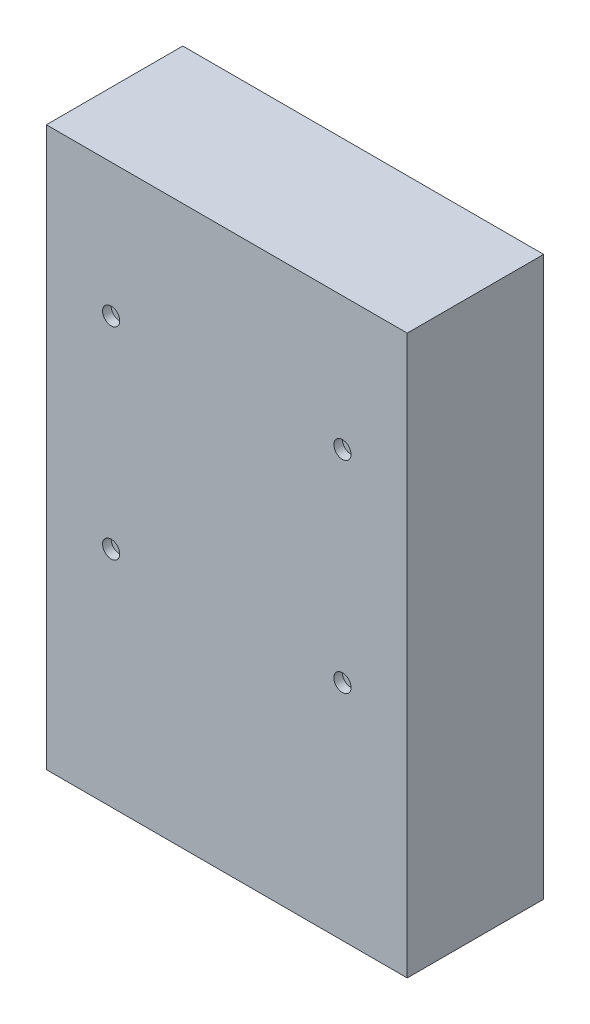
from build123d import *

# Parameters (mm, degrees)
SKETCH1_W               = 42
SKETCH1_H               = 65
BOSS_EXTRUDE1_DEPTH     = 15.875
CUT_EXTRUDE1_DEPTH      = 42.824222946
CUT_EXTRUDE1_DEPTH_BACK = 1
SKETCH2_R               = 1


with BuildPart() as part:
    # Sketch1 → Boss-Extrude1 (new body)
    with BuildSketch(Plane.XY):
        Rectangle(SKETCH1_W, SKETCH1_H)
    extrude(amount=BOSS_EXTRUDE1_DEPTH)

    # Sketch2 → Cut-Extrude1 (cut, two sides: drawn at the far end of the back side and taken through both)
    with BuildSketch(Plane.XY.offset(15.875).offset(-CUT_EXTRUDE1_DEPTH_BACK)):
        with Locations((-13.459539776, -6.5)):
            Circle(SKETCH2_R)
        with Locations((-13.459539776, 17)):
            Circle(SKETCH2_R)
        with Locations((13.459539776, 17)):
            Circle(SKETCH2_R)
        with Locations((13.459539776, -6.5)):
            Circle(SKETCH2_R)
    extrude(amount=CUT_EXTRUDE1_DEPTH + CUT_EXTRUDE1_DEPTH_BACK, mode=Mode.SUBTRACT)


solid = part.part
